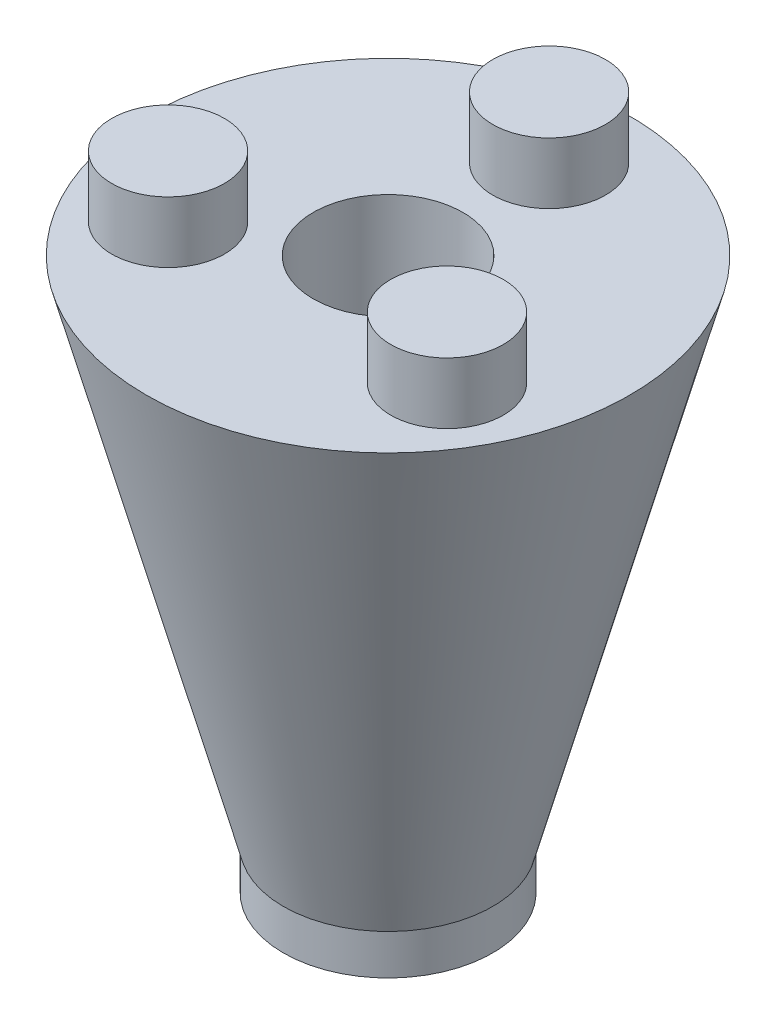
from build123d import *

# Parameters (mm, degrees)
SKETCH1_R            = 6.500000081
ANGLEBODY_DEPTH      = 31.75
ANGLEBODY_DRAFT      = -15
SKETCH2_R            = 4.649999971
CENTERHOLE_DEPTH     = 39.190389178
SKETCH2_3_R          = 3.499999985
F_40TPEGS_DEPTH      = 3.80000002
SKETCH3_R            = 6.500000081
SKETCH3_R_2          = 3.300000004
F_20TINTERFACE_DEPTH = 2.50000008


with BuildPart() as part:
    # Sketch1 → AngleBody (with draft: the straight prism first)
    with BuildSketch(Plane(origin=(0, 0, 0), x_dir=(1, 0, 0), z_dir=(0, 1, 0))):
        Circle(SKETCH1_R)
    extrude(amount=ANGLEBODY_DEPTH)
    # AngleBody: the draft: its side faces are tilted about the plane it starts from
    anglebody_sides = [part.faces().sort_by_distance(p)[0] for p in [
        (-6.500000081, 15.875, 0),
    ]]
    draft(anglebody_sides, Plane(origin=(0, 0, 0), x_dir=(1, 0, 0), z_dir=(0, 1, 0)), ANGLEBODY_DRAFT)

    # Sketch2 → CenterHole (cut, through all)
    with BuildSketch(Plane(origin=(0, 31.75, 0), x_dir=(1, 0, 0), z_dir=(0, 1, 0))):
        Circle(SKETCH2_R)
    extrude(amount=-CENTERHOLE_DEPTH, mode=Mode.SUBTRACT)

    # Sketch2<3> → 40tPegs (add)
    with BuildSketch(Plane(origin=(0, 31.75, 0), x_dir=(1, 0, 0), z_dir=(0, 1, 0))):
        with Locations((-8.660254095, -5.000000033)):
            Circle(SKETCH2_3_R)
        with Locations((8.660254095, -5.000000033)):
            Circle(SKETCH2_3_R)
        with Locations((0, 10.000000066)):
            Circle(SKETCH2_3_R)
    extrude(amount=F_40TPEGS_DEPTH)

    # Sketch3 → 20tInterface (add)
    with BuildSketch(Plane.XZ):
        Circle(SKETCH3_R)
        Circle(SKETCH3_R_2, mode=Mode.SUBTRACT)
    extrude(amount=F_20TINTERFACE_DEPTH)


solid = part.part
